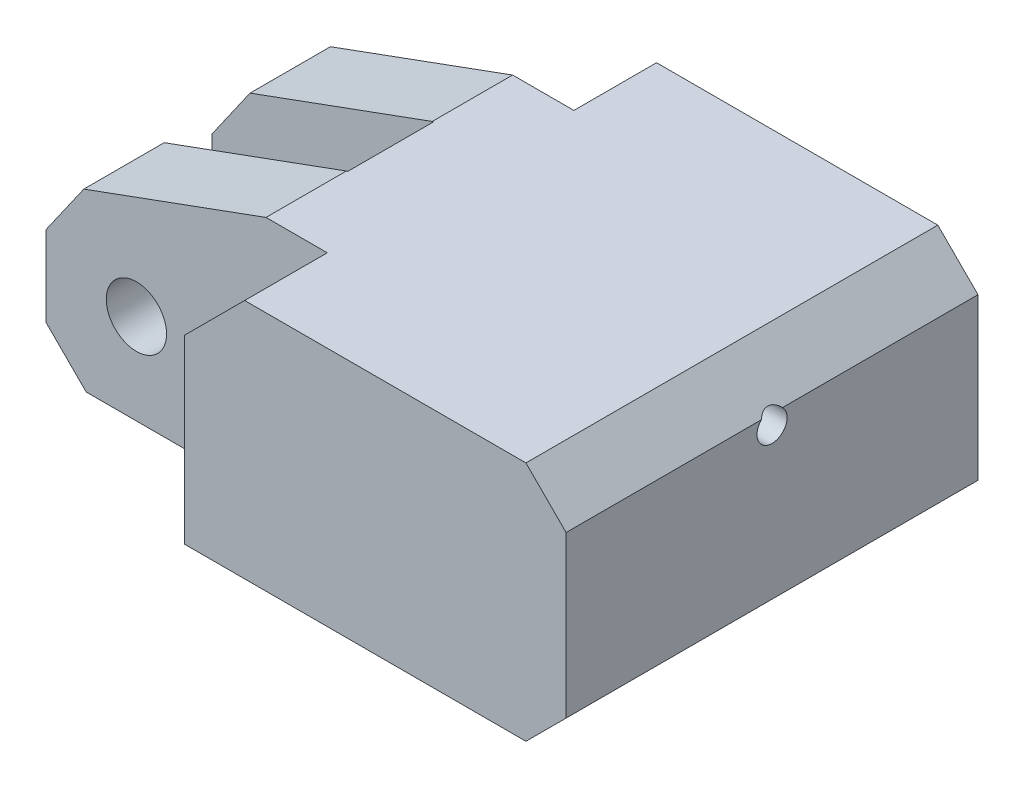
from build123d import *
from OCP.BRepFilletAPI import BRepFilletAPI_MakeChamfer

# Parameters (mm, degrees)
SKETCH_2_W          = 20.5
SKETCH_2_H          = 12
EXTRUDE_1_DEPTH     = 30
SKETCH_3_W          = 22
SKETCH_3_H          = 4.27428741
CUT_EXTRUDE_1_DEPTH = 34.897824414
SKETCH_10_W         = 17.106520138
SKETCH_10_H         = 9.063555791
CUT_EXTRUDE_3_DEPTH = 34.897824414
SKETCH_11_R         = 1.5
CUT_EXTRUDE_6_DEPTH = 35.706461629
SKETCH_12_R         = 0.75
CUT_EXTRUDE_4_DEPTH = 12
CUT_EXTRUDE_7_DEPTH = 37.827299657
CHAMFER_5_SIZE      = 2
CHAMFER_6_SIZE      = 2
CHAMFER_6_SIZE2     = 2.003351387
SKETCH_14_R         = 0.75
CUT_EXTRUDE_5_DEPTH = 23.406751215
CHAMFER_8_SIZE      = 3
CUT_EXTRUDE_8_DEPTH = 10


with BuildPart() as part:
    # Эскиз2 → Вытянуть1 (new body)
    with BuildSketch(Plane(origin=(0, 0, 0), x_dir=(0, 0, -1), z_dir=(1, 0, 0))):
        Rectangle(SKETCH_2_W, SKETCH_2_H)
    extrude(amount=EXTRUDE_1_DEPTH)

    # Эскиз3 → Вырез-Вытянуть1 (cut, through all)
    with BuildSketch(Plane(origin=(0, 6, 0), x_dir=(1, 0, 0), z_dir=(0, 1, 0))):
        Rectangle(SKETCH_3_W, SKETCH_3_H)
    extrude(amount=-CUT_EXTRUDE_1_DEPTH, mode=Mode.SUBTRACT)

    # Эскиз10 → Вырез-Вытянуть3 (cut, through all)
    with BuildSketch(Plane(origin=(0, 6, 0), x_dir=(1, 0, 0), z_dir=(0, 1, 0))):
        with Locations((2.446739931, 10.668921601)):
            Rectangle(SKETCH_10_W, SKETCH_10_H)
        with Locations((2.446739931, -10.668921601)):
            Rectangle(SKETCH_10_W, SKETCH_10_H)
    extrude(amount=-CUT_EXTRUDE_3_DEPTH, mode=Mode.SUBTRACT)

    # Эскиз11 → Вытянуть6 (cut, through all)
    with BuildSketch(Plane.XY.offset(6.137143705)):
        with Locations((4.5, -1.5)):
            Circle(SKETCH_11_R)
    extrude(amount=-CUT_EXTRUDE_6_DEPTH, mode=Mode.SUBTRACT)

    # Эскиз12 → Вырез-Вытянуть4 (cut)
    with BuildSketch(Plane.ZY.offset(-11)):
        with Locations((-1.791386219, -3.407348241)):
            Circle(SKETCH_12_R)
    extrude(amount=-CUT_EXTRUDE_4_DEPTH, mode=Mode.SUBTRACT)

    # Эскиз13 → Вытянуть7 (cut, through all)
    with BuildSketch(Plane.XY.offset(10.25)):
        Polygon((10.95, 6), (0, 6), (0, 2), align=None)
        Polygon((40.005782236, 6), (40.005782236, 2), (30.005782236, 6), align=None)
    extrude(amount=-CUT_EXTRUDE_7_DEPTH, mode=Mode.SUBTRACT)

    # Фаска5
    chamfer_5_edges = [part.edges().sort_by_distance(p)[0] for p in [
        (0, -6, 4.137143705),
        (0, -6, -4.137143705),
        (30, -6, 0),
        (30, 6, 0),
    ]]
    chamfer(chamfer_5_edges, length=CHAMFER_5_SIZE)

    # Фаска6: one chamfer whose edges measure the first distance from different faces: ONE call of the kernel's chamfer builder (chamfer() names one face for all edges)
    chamfer_6_edges_1 = [part.edges().sort_by_distance(p)[0] for p in [
        (0, 2, 4.137143705),
    ]]
    chamfer_6_side_1 = [part.faces().sort_by_distance(p)[0] for p in [
        (0, -1, 4.137143705),
    ]]
    chamfer_6_edges_2 = [part.edges().sort_by_distance(p)[0] for p in [
        (0, 2, -4.137143705),
    ]]
    chamfer_6_side_2 = [part.faces().sort_by_distance(p)[0] for p in [
        (0, -1, -4.137143705),
    ]]
    chamfer_6 = BRepFilletAPI_MakeChamfer(part.part.solid().wrapped)
    for e in chamfer_6_edges_1:
        chamfer_6.Add(CHAMFER_6_SIZE, CHAMFER_6_SIZE2, e.wrapped, chamfer_6_side_1[0].wrapped)  # the first distance lies on this face
    for e in chamfer_6_edges_2:
        chamfer_6.Add(CHAMFER_6_SIZE, CHAMFER_6_SIZE2, e.wrapped, chamfer_6_side_2[0].wrapped)  # the first distance lies on this face
    add(Compound.cast(chamfer_6.Shape()), mode=Mode.REPLACE)

    # Эскиз14 → Вырез-Вытянуть5 (cut, through all)
    with BuildSketch(Plane.ZY.offset(-11)):
        with Locations((0, 3.465363476)):
            Circle(SKETCH_14_R)
    extrude(amount=-CUT_EXTRUDE_5_DEPTH, mode=Mode.SUBTRACT)

    # Фаска8
    chamfer_8_edges = [part.edges().sort_by_distance(p)[0] for p in [
        (11, 6, 8.193571852),
        (11, 6, -8.193571852),
    ]]
    chamfer(chamfer_8_edges, length=CHAMFER_8_SIZE)

    # Эскиз15 → Вытянуть8 (cut)
    with BuildSketch(Plane.XZ.offset(6)):
        with BuildLine():
            Line((16, 6.25), (25, 6.25))
            ThreePointArc((25, 6.25), (26.414213562, 5.664213562), (27, 4.25))
            Line((27, 4.25), (27, -4.25))
            ThreePointArc((27, -4.25), (26.414213562, -5.664213562), (25, -6.25))
            Line((25, -6.25), (16, -6.25))
            ThreePointArc((16, -6.25), (14.585786438, -5.664213562), (14, -4.25))
            Line((14, -4.25), (14, 4.25))
            ThreePointArc((14, 4.25), (14.585786438, 5.664213562), (16, 6.25))
        make_face()
    extrude(amount=-CUT_EXTRUDE_8_DEPTH, mode=Mode.SUBTRACT)


solid = part.part
